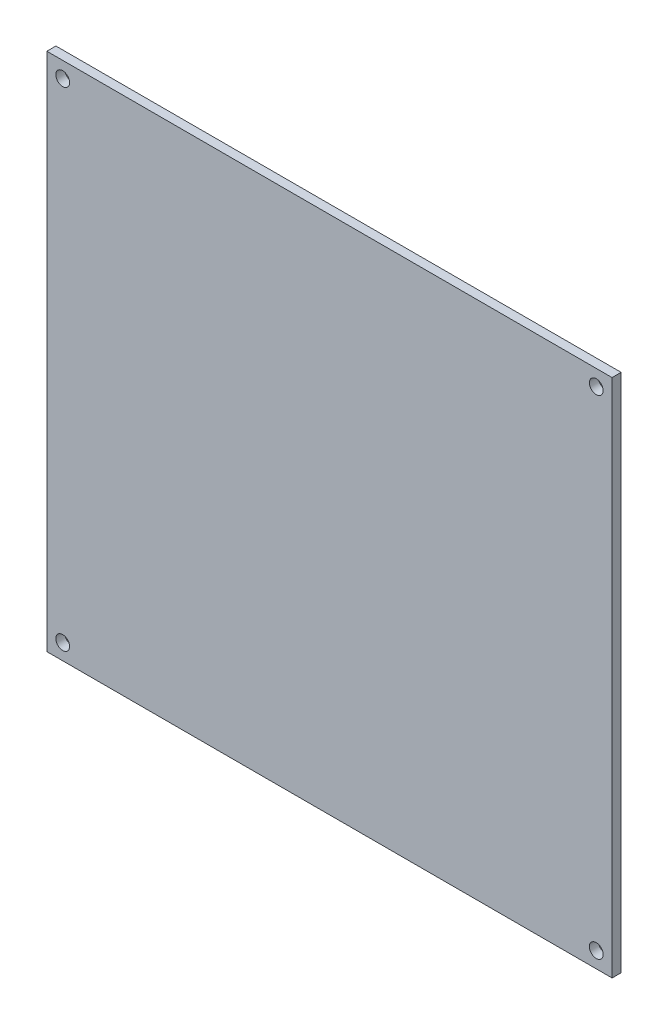
from build123d import *
from OCP.BRepFilletAPI import BRepFilletAPI_MakeChamfer

# Parameters (mm, degrees)
SKETCH1_W            = 125
SKETCH1_H            = 90
BOSS_EXTRUDE1_DEPTH  = 115
SHELL1_T             = -2
SKETCH4_W            = 67.8
SKETCH4_H            = 16.7
CUT_EXTRUDE1_DEPTH   = 1
SKETCH5_R            = 3.25
CUT_EXTRUDE2_DEPTH   = 37
SKETCH6_W            = 1
SKETCH6_H            = 111
BOSS_EXTRUDE2_DEPTH  = 10
FILLET1_SIZE         = 4
FILLET1_SIZE_2       = 10
FILLET2_R            = 1
SKETCH7_R            = 13
CUT_EXTRUDE3_DEPTH   = 10
SKETCH8_W            = 24
SKETCH8_H            = 49.041471127
BOSS_EXTRUDE3_DEPTH  = 12
CHAMFER1_SIZE        = 10
CHAMFER1_SIZE2       = 11.917535926
CUT_EXTRUDE4_DEPTH   = 40
SKETCH10_R           = 1.4
BOSS_EXTRUDE4_DEPTH  = 10
FILLET3_R            = 1
SKETCH11_R           = 3.25
CUT_EXTRUDE5_DEPTH   = 161
SKETCH13_R           = 5.75
CUT_EXTRUDE6_DEPTH   = 161
SKETCH14_R           = 6
SKETCH14_R_2         = 5.5
BOSS_EXTRUDE5_DEPTH  = 1
FILLET4_R            = 0.5
FILLET5_R            = 0.5
CUT_EXTRUDE7_DEPTH   = 9
BOSS_EXTRUDE6_DEPTH  = 20
CHAMFER2_SIZE        = 10
CHAMFER2_SIZE2       = 9.656887748
CHAMFER3_SIZE        = 5
CHAMFER3_SIZE2       = 9.813052528
SKETCH19_R           = 1.525
CUT_EXTRUDE8_DEPTH   = 18
SKETCH23_W           = 103.271757447
SKETCH23_H           = 129.791226308
CUT_EXTRUDE9_DEPTH   = 210
SKETCH24_W           = 125
SKETCH24_H           = 115
BOSS_EXTRUDE10_DEPTH = 1
CUT_EXTRUDE10_START  = -2
SKETCH25_R           = 1.525
CUT_EXTRUDE10_DEPTH  = 2


# Some blends are built 0.0001 mm under size
with BuildPart() as part:
    # Sketch1 → Boss-Extrude1 (new body)
    with BuildSketch(Plane(origin=(0, 0, 0), x_dir=(1, 0, 0), z_dir=(0, 1, 0))):
        Rectangle(SKETCH1_W, SKETCH1_H)
    extrude(amount=BOSS_EXTRUDE1_DEPTH)

    # Shell1
    shell1_openings = [part.faces().sort_by_distance(p)[0] for p in [
        (0, 57.5, 45),
    ]]
    offset(amount=SHELL1_T, openings=shell1_openings, kind=Kind.INTERSECTION)

    # Sketch4 → Cut-Extrude1 (cut)
    with BuildSketch(Plane.XZ.offset(-113)):
        with Locations((-26.6, -34.65)):
            Rectangle(SKETCH4_W, SKETCH4_H)
    extrude(amount=-CUT_EXTRUDE1_DEPTH, mode=Mode.SUBTRACT)

    # Sketch5 → Cut-Extrude2 (cut)
    with BuildSketch(Plane.XZ.offset(-114)):
        with Locations(Location((-50.5, -34.65, 0), (0, 0, 270))):
            Circle(SKETCH5_R)
    extrude(amount=-CUT_EXTRUDE2_DEPTH, mode=Mode.SUBTRACT)

    # Sketch6 → Boss-Extrude2 (add)
    with BuildSketch(Plane.XY.offset(-43)):
        with Locations((7.8, 57.5)):
            Rectangle(SKETCH6_W, SKETCH6_H)
    extrude(amount=BOSS_EXTRUDE2_DEPTH)

    # Fillet1
    # a fillet whose section is not a circle: 10, 4 mm, written as the material it adds along each edge
    with BuildSketch(Plane(origin=(8.3, 2, -43), x_dir=(1, 0, 0), z_dir=(0, 1, 0))) as fillet1_piece_1:
        with BuildLine():
            Bezier((FILLET1_SIZE, 0), (0, 0), (0, -FILLET1_SIZE_2), weights=[1, 0.707106781, 1])
            Line((0, -FILLET1_SIZE_2), (0, 0))
            Line((0, 0), (FILLET1_SIZE, 0))
        make_face()
    extrude(amount=111)

    # Fillet2
    fillet2_edges = [part.edges().sort_by_distance(p)[0] for p in [
        (8.3, 57.5, -33),
    ]]
    fillet(fillet2_edges, radius=FILLET2_R)

    # Sketch7 → Cut-Extrude3 (cut)
    with BuildSketch(Plane(origin=(62.5, 0, 0), x_dir=(0, 0, -1), z_dir=(1, 0, 0))):
        with Locations((0, 35)):
            Circle(SKETCH7_R)
    extrude(amount=-CUT_EXTRUDE3_DEPTH, mode=Mode.SUBTRACT)

    # Sketch8 → Boss-Extrude3 (add)
    with BuildSketch(Plane.ZY.offset(62.5)):
        with Locations((15, 90.479264437)):
            Rectangle(SKETCH8_W, SKETCH8_H)
    extrude(amount=BOSS_EXTRUDE3_DEPTH)

    # Chamfer1
    chamfer1_edges = [part.edges().sort_by_distance(p)[0] for p in [
        (-62.5, 90.479264436, 3),
    ]]
    chamfer1_side = [part.faces().sort_by_distance(p)[0] for p in [
        (-62.5, 53.268405144, -1.924661569),
    ]]
    chamfer(chamfer1_edges, length=CHAMFER1_SIZE, length2=CHAMFER1_SIZE2, reference=chamfer1_side[0])

    # Sketch9 → Cut-Extrude4 (cut)
    with BuildSketch(Plane(origin=(0, 115, 0), x_dir=(1, 0, 0), z_dir=(0, 1, 0))):
        Polygon((-64.139712889, -5), (-72.5, -5), (-72.5, -21.393203559), (-72.5, -25), (-64.139712889, -25), align=None)
    extrude(amount=-CUT_EXTRUDE4_DEPTH, mode=Mode.SUBTRACT)

    # Sketch10 → Boss-Extrude4 (add)
    with BuildSketch(Plane.XY.offset(-43)):
        with Locations((22.3, 78.5)):
            Circle(SKETCH10_R)
        with Locations(Location((51.3, 78.5, 0), (0, 0, 180))):
            Circle(SKETCH10_R)
        with Locations((51.3, 105)):
            Circle(SKETCH10_R)
        with Locations(Location((22.3, 105, 0), (0, 0, 180))):
            Circle(SKETCH10_R)
    extrude(amount=BOSS_EXTRUDE4_DEPTH)

    # Fillet3
    fillet3_edges = [part.edges().sort_by_distance(p)[0] for p in [
        (23.7, 105, -43),
        (49.9, 105, -43),
        (52.7, 78.5, -43),
        (20.9, 78.5, -43),
    ]]
    fillet(fillet3_edges, radius=FILLET3_R)

    # Sketch11 → Cut-Extrude5 (cut)
    with BuildSketch(Plane.XZ.offset(-113)):
        with Locations(Location((42.3, -38.5, 0), (0, 0, 270))):
            Circle(SKETCH11_R)
    extrude(amount=-CUT_EXTRUDE5_DEPTH, mode=Mode.SUBTRACT)

    # Sketch13 → Cut-Extrude6 (cut)
    with BuildSketch(Plane(origin=(-60.5, 0, 0), x_dir=(0, 0, -1), z_dir=(1, 0, 0))):
        with Locations((18, 25)):
            Circle(SKETCH13_R)
    extrude(amount=-CUT_EXTRUDE6_DEPTH, mode=Mode.SUBTRACT)

    # Sketch14 → Boss-Extrude5 (add)
    # profile 1 of 4: a face of its own
    with BuildSketch(Plane.XZ):
        with Locations(Location((-55.5, 38, 0), (0, 0, 270))):
            Circle(SKETCH14_R)
        with Locations(Location((-55.5, 38, 0), (0, 0, 270))):
            Circle(SKETCH14_R_2, mode=Mode.SUBTRACT)
    # profile 2 of 4: a face of its own
    with BuildSketch(Plane.XZ):
        with Locations(Location((55.5, 38, 0), (0, 0, 270))):
            Circle(SKETCH14_R)
        with Locations(Location((55.5, 38, 0), (0, 0, 270))):
            Circle(SKETCH14_R_2, mode=Mode.SUBTRACT)
    # profile 3 of 4: a face of its own
    with BuildSketch(Plane.XZ):
        with Locations(Location((55.5, -38, 0), (0, 0, 270))):
            Circle(SKETCH14_R)
        with Locations(Location((55.5, -38, 0), (0, 0, 270))):
            Circle(SKETCH14_R_2, mode=Mode.SUBTRACT)
    # profile 4 of 4: a face of its own
    with BuildSketch(Plane.XZ):
        with Locations(Location((-55.5, -38, 0), (0, 0, 270))):
            Circle(SKETCH14_R)
    extrude(amount=BOSS_EXTRUDE5_DEPTH)

    # Fillet4
    fillet4_edges = [part.edges().sort_by_distance(p)[0] for p in [
        (-55.5, -1, 44),
        (-55.5, 0, 44),
    ]]
    fillet(fillet4_edges, radius=FILLET4_R - 0.0001)  # a hair under: the kernel refuses the full size

    # Fillet5
    fillet5_edges = [part.edges().sort_by_distance(p)[0] for p in [
        (55.5, 0, -32),
        (55.5, -1, -32),
        (55.5, 0, 44),
        (55.5, -1, 44),
        (-55.5, 0, -32),
        (-55.5, -1, -32),
    ]]
    fillet(fillet5_edges, radius=FILLET5_R - 0.0001)  # a hair under: the kernel refuses the full size

    # Sketch17 → Cut-Extrude7 (cut)
    with BuildSketch(Plane(origin=(0, 115, 0), x_dir=(1, 0, 0), z_dir=(0, 1, 0))):
        with BuildLine():
            ThreePointArc((25, -35), (20.732233047, -33.232233047), (22.5, -37.5))
            Line((22.5, -37.5), (22.5, -35))
            Line((22.5, -35), (25, -35))
        make_face()
        with BuildLine():
            Line((22.5, -35), (22.5, -37.5))
            ThreePointArc((22.5, -37.5), (24.267766953, -36.767766953), (25, -35))
            Line((25, -35), (22.5, -35))
        make_face()
        with BuildLine():
            ThreePointArc((32, -35), (29.5, -32.5), (27, -35))
            Line((27, -35), (32, -35))
        make_face()
        with BuildLine():
            Line((32, -35), (27, -35))
            ThreePointArc((27, -35), (29.5, -37.5), (32, -35))
        make_face()
        with BuildLine():
            ThreePointArc((39, -35), (36.5, -32.5), (34, -35))
            Line((34, -35), (39, -35))
        make_face()
        with BuildLine():
            Line((39, -35), (34, -35))
            ThreePointArc((34, -35), (36.5, -37.5), (39, -35))
        make_face()
        with BuildLine():
            ThreePointArc((46, -35), (43.5, -32.5), (41, -35))
            Line((41, -35), (46, -35))
        make_face()
        with BuildLine():
            Line((46, -35), (41, -35))
            ThreePointArc((41, -35), (43.5, -37.5), (46, -35))
        make_face()
    extrude(amount=-CUT_EXTRUDE7_DEPTH, mode=Mode.SUBTRACT)

    # Sketch18 → Boss-Extrude6 (add)
    with BuildSketch(Plane.XY.offset(45)):
        Polygon((-50.5, 2), (-60.5, 12), (-60.5, 2), align=None)
        Polygon((-60.5, 113), (-60.5, 103), (-50.5, 112.988112704), align=None)
        Polygon((50.5, 112.988112704), (60.5, 103), (60.5, 113), align=None)
        Polygon((60.5, 12), (50.5, 2), (60.5, 2), align=None)
    extrude(amount=-BOSS_EXTRUDE6_DEPTH)

    # Chamfer2
    chamfer2_edges = [part.edges().sort_by_distance(p)[0] for p in [
        (-55.5, 2, 25),
        (55.5, 2, 25),
    ]]
    chamfer2_side = [part.faces().sort_by_distance(p)[0] for p in [
        (-0.015179925, 2, -0.25697617),
    ]]
    chamfer(chamfer2_edges, length=CHAMFER2_SIZE, length2=CHAMFER2_SIZE2, reference=chamfer2_side[0])

    # Chamfer3: one chamfer whose edges measure the first distance from different faces: ONE call of the kernel's chamfer builder (chamfer() names one face for all edges)
    chamfer3_edges_1 = [part.edges().sort_by_distance(p)[0] for p in [
        (-60.5, 108, 25),
    ]]
    chamfer3_side_1 = [part.faces().sort_by_distance(p)[0] for p in [
        (-60.5, 58.240348279, -0.431861074),
    ]]
    chamfer3_edges_2 = [part.edges().sort_by_distance(p)[0] for p in [
        (60.5, 108, 25),
    ]]
    chamfer3_side_2 = [part.faces().sort_by_distance(p)[0] for p in [
        (60.5, 59.1464465, -0.600556504),
    ]]
    chamfer3 = BRepFilletAPI_MakeChamfer(part.part.solid().wrapped)
    for e in chamfer3_edges_1:
        chamfer3.Add(CHAMFER3_SIZE, CHAMFER3_SIZE2, e.wrapped, chamfer3_side_1[0].wrapped)  # the first distance lies on this face
    for e in chamfer3_edges_2:
        chamfer3.Add(CHAMFER3_SIZE, CHAMFER3_SIZE2, e.wrapped, chamfer3_side_2[0].wrapped)  # the first distance lies on this face
    add(Compound.cast(chamfer3.Shape()), mode=Mode.REPLACE)

    # Sketch19 → Cut-Extrude8 (cut)
    with BuildSketch(Plane.XY.offset(45)):
        with Locations((-59, 3.5)):
            Circle(SKETCH19_R)
        with BuildLine():
            ThreePointArc((-59.282778619, 112.998553053), (-59.001812811, 109.975001077), (-58.713659436, 112.997876524))
            Line((-58.713659436, 112.997876524), (-59.282778619, 112.998553053))
        make_face()
        with BuildLine():
            Line((59.282778619, 112.998553053), (58.713659436, 112.997876524))
            ThreePointArc((58.713659436, 112.997876524), (59.001812811, 109.975001077), (59.282778619, 112.998553053))
        make_face()
        with BuildLine():
            ThreePointArc((59.275, 113), (59, 113.025), (58.725, 113))
            Line((58.725, 113), (59.275, 113))
        make_face()
        with Locations((59, 3.5)):
            Circle(SKETCH19_R)
    extrude(amount=-CUT_EXTRUDE8_DEPTH, mode=Mode.SUBTRACT)

    # Sketch23 → Cut-Extrude9 (cut)
    with BuildSketch(Plane(origin=(62.5, 0, 0), x_dir=(0, 0, -1), z_dir=(1, 0, 0))):
        with Locations((7.635878724, 50.104386846)):
            Rectangle(SKETCH23_W, SKETCH23_H)
    extrude(amount=-CUT_EXTRUDE9_DEPTH, mode=Mode.SUBTRACT)

    # Sketch24 → Boss-Extrude10 (add)
    with BuildSketch(Plane.XY.offset(45)):
        with Locations((0, 57.5)):
            Rectangle(SKETCH24_W, SKETCH24_H)
    extrude(amount=BOSS_EXTRUDE10_DEPTH)

    # Sketch25 → Cut-Extrude10 (cut)
    with BuildSketch(Plane(origin=(0, 0, 44), x_dir=(-1, 0, 0), z_dir=(0, 0, -1)).offset(CUT_EXTRUDE10_START)):
        with BuildLine():
            ThreePointArc((-59.282778619, 112.998553053), (-59.973238821, 110.325933904), (-57.475, 111.5))
            ThreePointArc((-57.475, 111.5), (-57.824777817, 112.471842487), (-58.713659436, 112.997876524))
            ThreePointArc((-58.713659436, 112.997876524), (-58.71932771, 112.998948987), (-58.725, 113))
            ThreePointArc((-58.725, 113), (-59, 113.025), (-59.275, 113))
            ThreePointArc((-59.275, 113), (-59.278890248, 112.999281571), (-59.282778619, 112.998553053))
        make_face()
        with Locations(Location((-59, 3.5, 0), (0, 0, 270))):
            Circle(SKETCH25_R)
        with Locations(Location((59, 3.5, 0), (0, 0, 270))):
            Circle(SKETCH25_R)
        with Locations(Location((59, 111.5, 0), (0, 0, 100.822340204))):
            Circle(SKETCH25_R)
    extrude(amount=CUT_EXTRUDE10_DEPTH, mode=Mode.SUBTRACT)


solid = part.part
